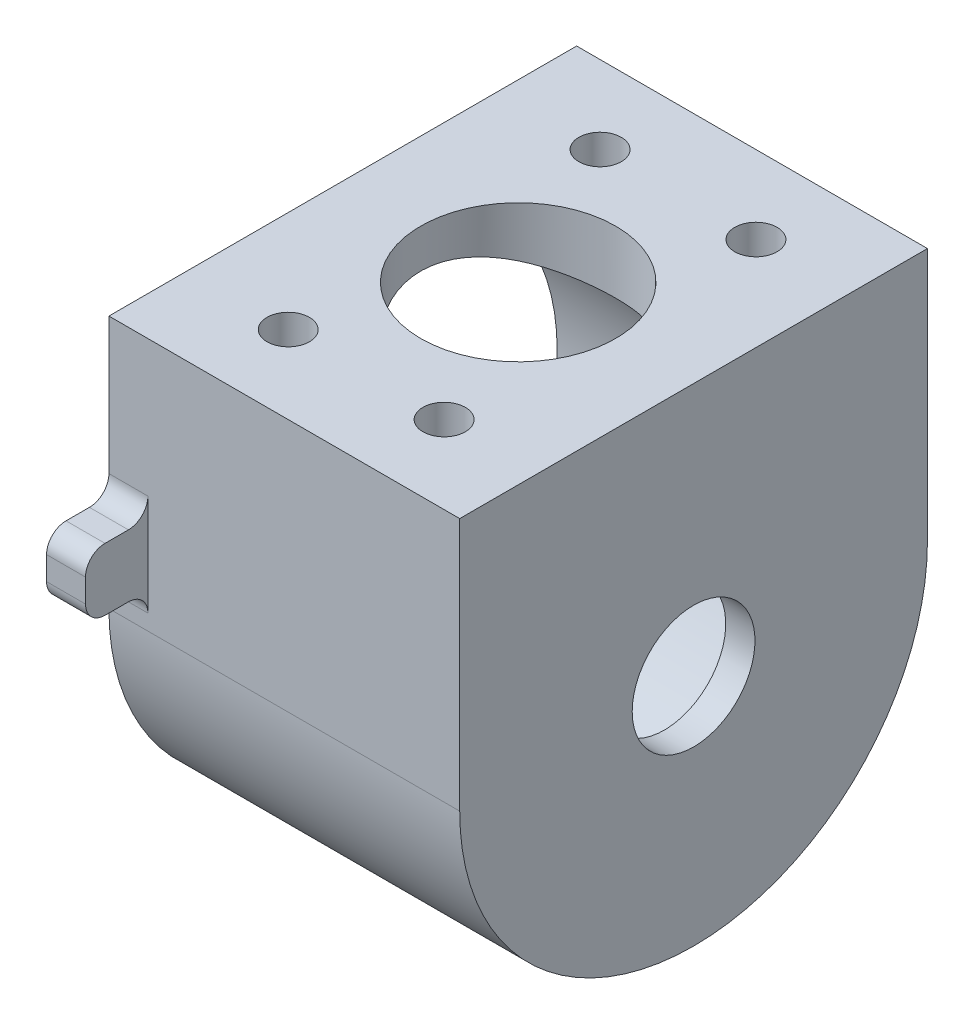
from build123d import *

# Parameters (mm, degrees)
BOSS_EXTRUDE1_DEPTH       = 28.575
SKETCH2_R                 = 17.4625
CUT_EXTRUDE1_DEPTH        = 26.19375
SKETCH3_R                 = 5
CUT_EXTRUDE2_DEPTH        = 39.404706031
F_8_32_TAPPED_HOLE1_D     = 3.4544
F_8_32_TAPPED_HOLE1_DEPTH = 5.588
F_8_32_TAPPED_HOLE1_TIP   = 1.037806461
SKETCH6_W                 = 5.08
SKETCH6_H                 = 5.08
BOSS_EXTRUDE2_DEPTH       = 3.175
FILLET1_R                 = 1.5875
CUT_EXTRUDE3_REACH        = 56.533
SKETCH7_R                 = 7.9375


with BuildPart() as part:
    # Sketch1 → Boss-Extrude1 (new body)
    with BuildSketch(Plane(origin=(0, 0, 0), x_dir=(0, 0, -1), z_dir=(1, 0, 0))):
        with BuildLine():
            Line((-19.05, 0), (-19.05, 20.6375))
            Line((-19.05, 20.6375), (19.05, 20.6375))
            Line((19.05, 20.6375), (19.05, 0))
            ThreePointArc((19.05, 0), (0, -19.05), (-19.05, 0))
        make_face()
    extrude(amount=BOSS_EXTRUDE1_DEPTH)

    # Sketch2 → Cut-Extrude1 (cut)
    with BuildSketch(Plane.ZY):
        Circle(SKETCH2_R)
    extrude(amount=-CUT_EXTRUDE1_DEPTH, mode=Mode.SUBTRACT)

    # Sketch3 → Cut-Extrude2 (cut, through all)
    with BuildSketch(Plane.ZY.offset(-26.19375)):
        Circle(SKETCH3_R)
    extrude(amount=-CUT_EXTRUDE2_DEPTH, mode=Mode.SUBTRACT)

    # #8-32 Tapped Hole1
    with Locations(Plane(origin=(0, 20.6375, 0), x_dir=(-1, 0, 0), z_dir=(0, 1, 0))):
        with Locations((-8.255, 12.7), (-8.255, -12.7), (-20.955, -12.7), (-20.955, 12.7), (-34.258152115, 14.428229267)):
            Hole(F_8_32_TAPPED_HOLE1_D / 2, depth=F_8_32_TAPPED_HOLE1_DEPTH)
            with Locations((0, 0, -(F_8_32_TAPPED_HOLE1_DEPTH + F_8_32_TAPPED_HOLE1_TIP / 2))):  # 118° drill point
                Cone(0, F_8_32_TAPPED_HOLE1_D / 2, F_8_32_TAPPED_HOLE1_TIP, mode=Mode.SUBTRACT)

    # Sketch6 → Boss-Extrude2 (add)
    with BuildSketch(Plane.ZY):
        with Locations((-21.59, 5.3975)):
            Rectangle(SKETCH6_W, SKETCH6_H)
    boss_extrude2 = extrude(amount=-BOSS_EXTRUDE2_DEPTH)

    # Mirror1: Boss-Extrude2 across plane
    add(boss_extrude2.mirror(Plane.XY))

    # Fillet1
    fillet1_edges = [part.edges().sort_by_distance(p)[0] for p in [
        (1.5875, 7.9375, -19.05),
        (1.5875, 7.9375, -24.13),
        (1.5875, 2.8575, -24.13),
        (1.5875, 2.8575, -19.05),
        (1.5875, 7.9375, 19.05),
        (1.5875, 7.9375, 24.13),
        (1.5875, 2.8575, 24.13),
        (1.5875, 2.8575, 19.05),
    ]]
    fillet(fillet1_edges, radius=FILLET1_R)

    # Sketch7 → Cut-Extrude3 (cut, up to next)
    with BuildSketch(Plane(origin=(0, 20.6375, 0), x_dir=(1, 0, 0), z_dir=(0, 1, 0)), mode=Mode.PRIVATE) as cut_extrude3_sk1:
        with Locations((14.2875, 0)):
            Circle(SKETCH7_R)
    cut_extrude3_tool1 = extrude(cut_extrude3_sk1.sketch, amount=-CUT_EXTRUDE3_REACH, mode=Mode.PRIVATE) & part.part
    add(cut_extrude3_tool1.solids().sort_by_distance((14.2875, 20.6375, 0))[0], mode=Mode.SUBTRACT)


solid = part.part
